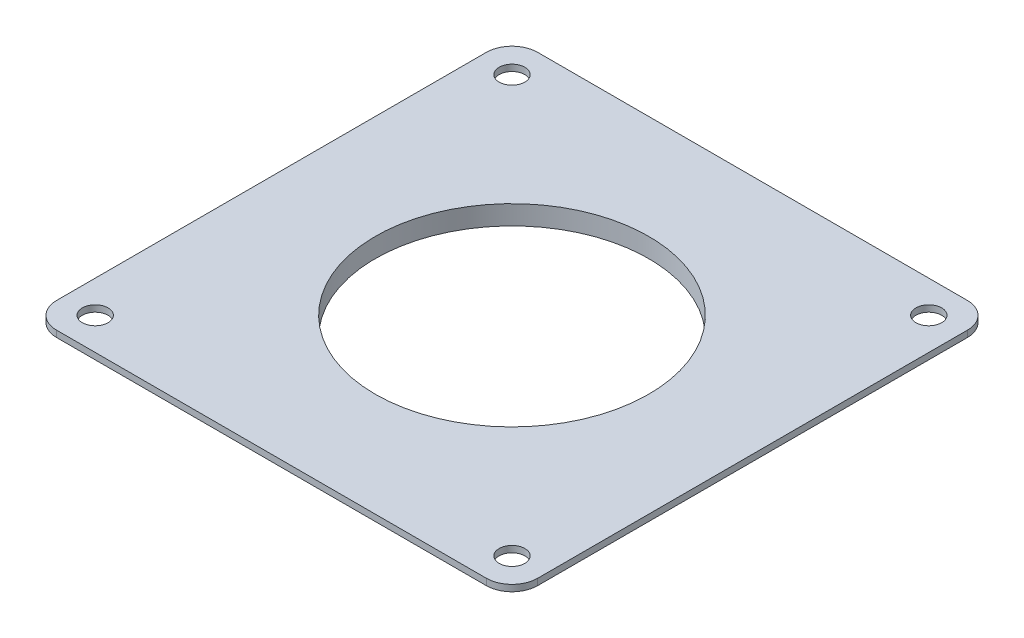
from build123d import *

# Parameters (mm, degrees)
BOSS_EXTRUDE1_DEPTH = 1.27
SKETCH2_R           = 38.1
BOSS_EXTRUDE2_DEPTH = 2.54
FILLET1_R           = 10.16
SKETCH3_R           = 27
CUT_EXTRUDE1_DEPTH  = 68.28310412
SKETCH4_R           = 2.54
CUT_EXTRUDE2_DEPTH  = 68.28310412


with BuildPart() as part:
    # Sketch1 → Boss-Extrude1 (new body)
    with BuildSketch(Plane(origin=(0, 0, 0), x_dir=(1, 0, 0), z_dir=(0, 1, 0))):
        with BuildLine():
            Line((-42.42, -47.5), (42.42, -47.5))
            ThreePointArc((42.42, -47.5), (46.012102448, -46.012102448), (47.5, -42.42))
            Line((47.5, -42.42), (47.5, 42.42))
            ThreePointArc((47.5, 42.42), (46.012102448, 46.012102448), (42.42, 47.5))
            Line((42.42, 47.5), (-42.42, 47.5))
            ThreePointArc((-42.42, 47.5), (-46.012102448, 46.012102448), (-47.5, 42.42))
            Line((-47.5, 42.42), (-47.5, -42.42))
            ThreePointArc((-47.5, -42.42), (-46.012102448, -46.012102448), (-42.42, -47.5))
        make_face()
    extrude(amount=BOSS_EXTRUDE1_DEPTH)

    # Sketch2 → Boss-Extrude2 (add)
    with BuildSketch(Plane.XZ):
        with Locations(Location((0, 0, 0), (0, 0, 270))):
            Circle(SKETCH2_R)
    extrude(amount=BOSS_EXTRUDE2_DEPTH)

    # Fillet1
    # the kernel refuses this fillet: 10.16 mm, written as the material it adds along each edge
    with BuildSketch(Plane(origin=(0, 0, 0), x_dir=(0, 0, -1), z_dir=(-1, 0, 0))) as fillet1_piece_1:
        with BuildLine():
            CenterArc((44.82020833, 10.16), FILLET1_R, 228.590377891, 41.409622109)
            Line((38.1, 2.54), (38.1, 0))
            Line((38.1, 0), (44.82020833, 0))
        make_face()
    revolve(axis=Axis((0, 0, 0), (0, -1, 0)))

    # Sketch3 → Cut-Extrude1 (cut, through all)
    with BuildSketch(Plane(origin=(0, 1.27, 0), x_dir=(1, 0, 0), z_dir=(0, 1, 0))):
        with Locations(Location((0, 0, 0), (0, 0, 270))):
            Circle(SKETCH3_R)
    extrude(amount=-CUT_EXTRUDE1_DEPTH, mode=Mode.SUBTRACT)

    # Sketch4 → Cut-Extrude2 (cut, through all)
    with BuildSketch(Plane(origin=(0, 1.27, 0), x_dir=(1, 0, 0), z_dir=(0, 1, 0))):
        with Locations(Location((-41.15, 41.15, 0), (0, 0, 270))):
            Circle(SKETCH4_R)
        with Locations(Location((41.15, 41.15, 0), (0, 0, 90))):
            Circle(SKETCH4_R)
        with Locations(Location((-41.15, -41.15, 0), (0, 0, 90))):
            Circle(SKETCH4_R)
        with Locations(Location((41.15, -41.15, 0), (0, 0, 270))):
            Circle(SKETCH4_R)
    extrude(amount=-CUT_EXTRUDE2_DEPTH, mode=Mode.SUBTRACT)


solid = part.part
